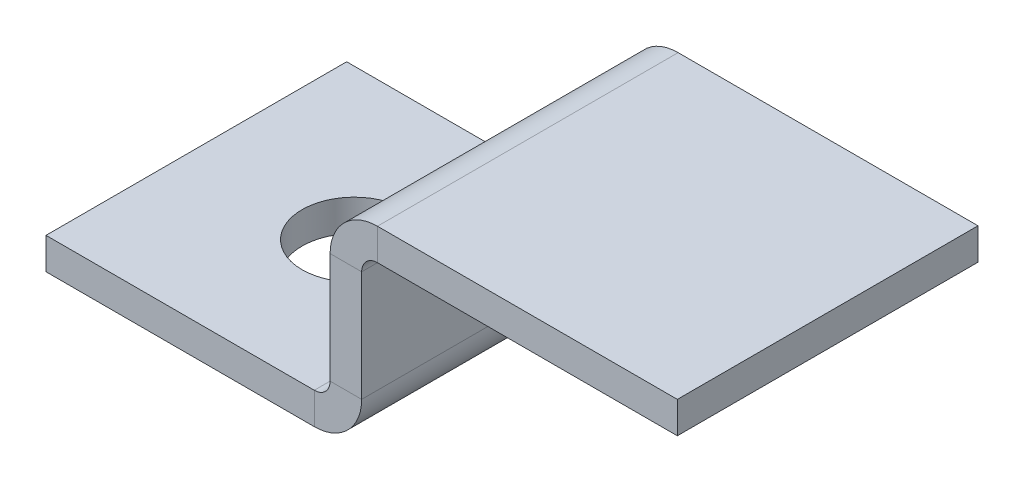
from build123d import *

# Parameters (mm, degrees)
BRIDA_BASE1_DEPTH                = 9.525
TALADRO_DE_MARGEN_PARA_M65_D     = 6.6
TALADRO_DE_MARGEN_PARA_M65_DEPTH = 11.62
TALADRO_DE_MARGEN_PARA_M65_TIP   = 1.982840043


# Sheet-metal steps are written as plain solids
with BuildPart() as part:
    # Croquis1 → Brida base1 (new, symmetric)
    with BuildSketch(Plane.XY):
        with BuildLine():
            Line((20, 11), (1, 11))
            ThreePointArc((1, 11), (0.292893219, 10.707106781), (0, 10))
            Line((0, 10), (0, 3))
            ThreePointArc((0, 3), (-0.878679656, 0.878679656), (-3, 0))
            Line((-3, 0), (-20, 0))
            Line((-20, 0), (-20, 2))
            Line((-20, 2), (-3, 2))
            ThreePointArc((-3, 2), (-2.292893219, 2.292893219), (-2, 3))
            Line((-2, 3), (-2, 10))
            ThreePointArc((-2, 10), (-1.121320344, 12.121320344), (1, 13))
            Line((1, 13), (20, 13))
            Line((20, 13), (20, 11))
        make_face()
    extrude(amount=BRIDA_BASE1_DEPTH, both=True)

    # Taladro de margen para M65
    with Locations(Plane(origin=(-10, 2, 0), x_dir=(1, 0, 0), z_dir=(0, 1, 0))):
        with Locations((0, 0)):
            Hole(TALADRO_DE_MARGEN_PARA_M65_D / 2, depth=TALADRO_DE_MARGEN_PARA_M65_DEPTH)
            with Locations((0, 0, -(TALADRO_DE_MARGEN_PARA_M65_DEPTH + TALADRO_DE_MARGEN_PARA_M65_TIP / 2))):  # 118° drill point
                Cone(0, TALADRO_DE_MARGEN_PARA_M65_D / 2, TALADRO_DE_MARGEN_PARA_M65_TIP, mode=Mode.SUBTRACT)


solid = part.part
